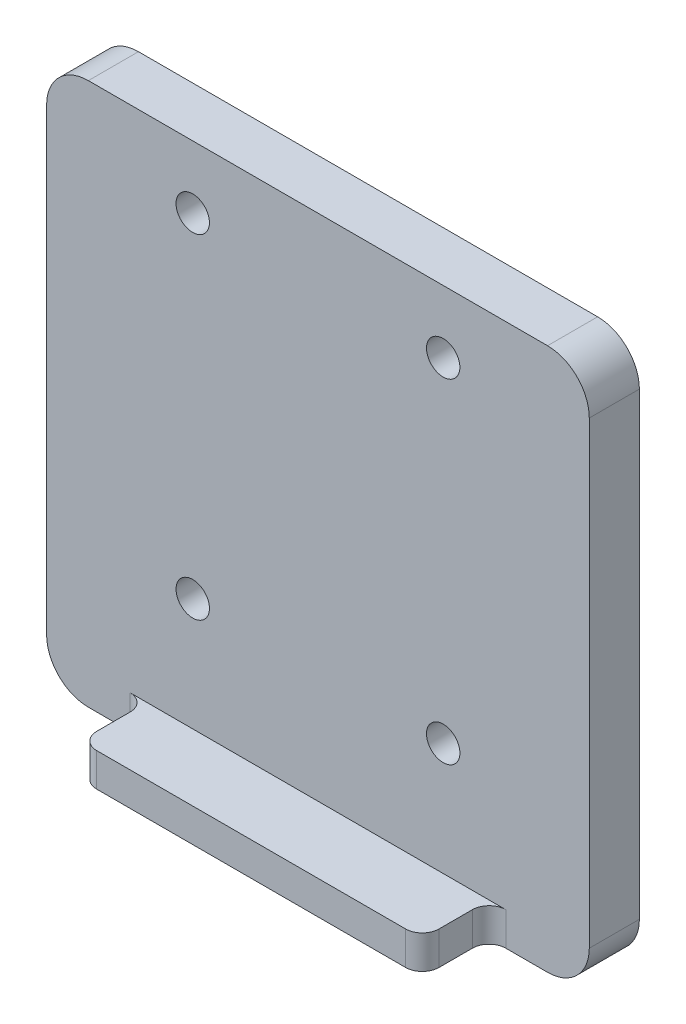
from build123d import *

# Parameters (mm, degrees)
SKETCH1_W           = 65
SKETCH1_H           = 65
BOSS_EXTRUDE1_DEPTH = 6
FILLET1_R           = 5
SKETCH2_W           = 41
SKETCH2_H           = 4
BOSS_EXTRUDE2_DEPTH = 8
FILLET2_R           = 2
SKETCH3_R           = 2
CUT_EXTRUDE1_DEPTH  = 49.046852134


with BuildPart() as part:
    # Sketch1 → Boss-Extrude1 (new body)
    with BuildSketch(Plane.XY):
        Rectangle(SKETCH1_W, SKETCH1_H)
    extrude(amount=BOSS_EXTRUDE1_DEPTH)

    # Fillet1
    fillet1_edges = [part.edges().sort_by_distance(p)[0] for p in [
        (32.5, -32.5, 3),
        (-32.5, -32.5, 3),
        (32.5, 32.5, 3),
        (-32.5, 32.5, 3),
    ]]
    fillet(fillet1_edges, radius=FILLET1_R)

    # Sketch2 → Boss-Extrude2 (add)
    with BuildSketch(Plane.XY.offset(6)):
        with Locations((0, -30.5)):
            Rectangle(SKETCH2_W, SKETCH2_H)
    extrude(amount=BOSS_EXTRUDE2_DEPTH)

    # Fillet2
    fillet2_edges = [part.edges().sort_by_distance(p)[0] for p in [
        (20.5, -30.5, 6),
        (20.5, -30.5, 14),
        (-20.5, -30.5, 14),
        (-20.5, -30.5, 6),
    ]]
    fillet(fillet2_edges, radius=FILLET2_R)

    # Sketch3 → Cut-Extrude1 (cut, through all)
    with BuildSketch(Plane(origin=(0, 0, 0), x_dir=(-1, 0, 0), z_dir=(0, 0, -1))):
        with Locations((-15, 25)):
            Circle(SKETCH3_R)
        with Locations((15, 25)):
            Circle(SKETCH3_R)
        with Locations((-15, -15)):
            Circle(SKETCH3_R)
        with Locations((15, -15)):
            Circle(SKETCH3_R)
    extrude(amount=-CUT_EXTRUDE1_DEPTH, mode=Mode.SUBTRACT)


solid = part.part
